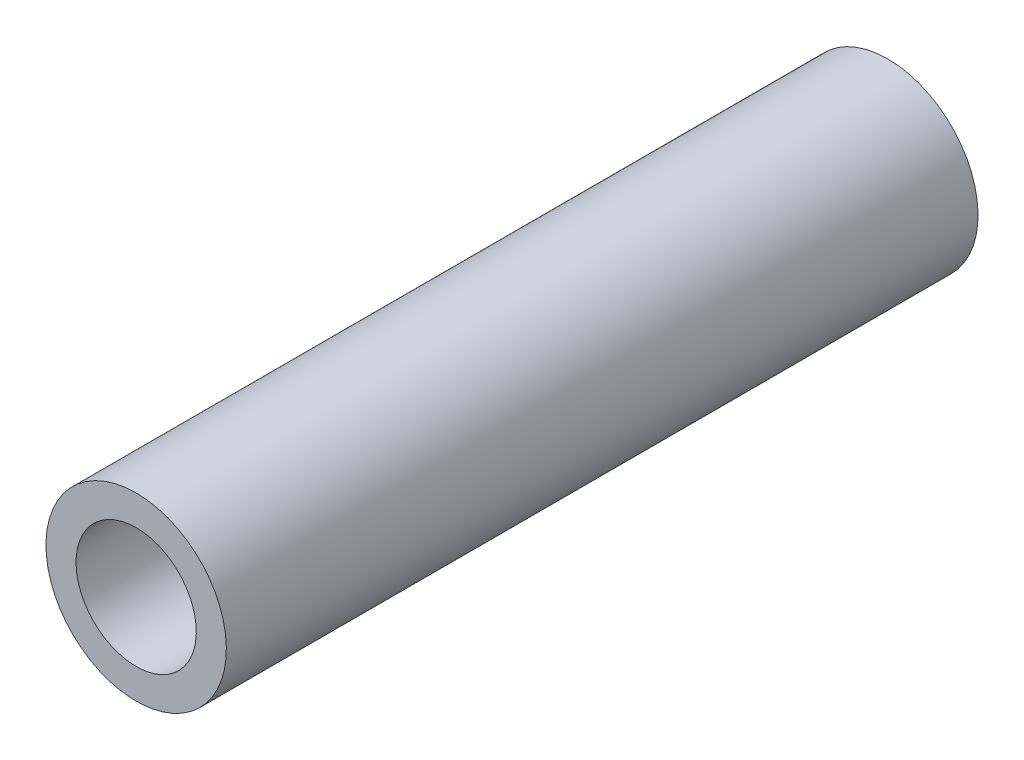
from build123d import *


with BuildPart() as part:
    # Sketch1 → Revolve1 (revolve)
    with BuildSketch(Plane(origin=(0, 0, 0), x_dir=(0, 0, -1), z_dir=(1, 0, 0))):
        Polygon((10, 0), (10, 4), (0, 4), (0, 6), (50, 6), (50, 4), (40, 4), (40, 0), align=None)
    revolve(axis=Axis((0, 0, -40), (0, 0, 1)))


solid = part.part
